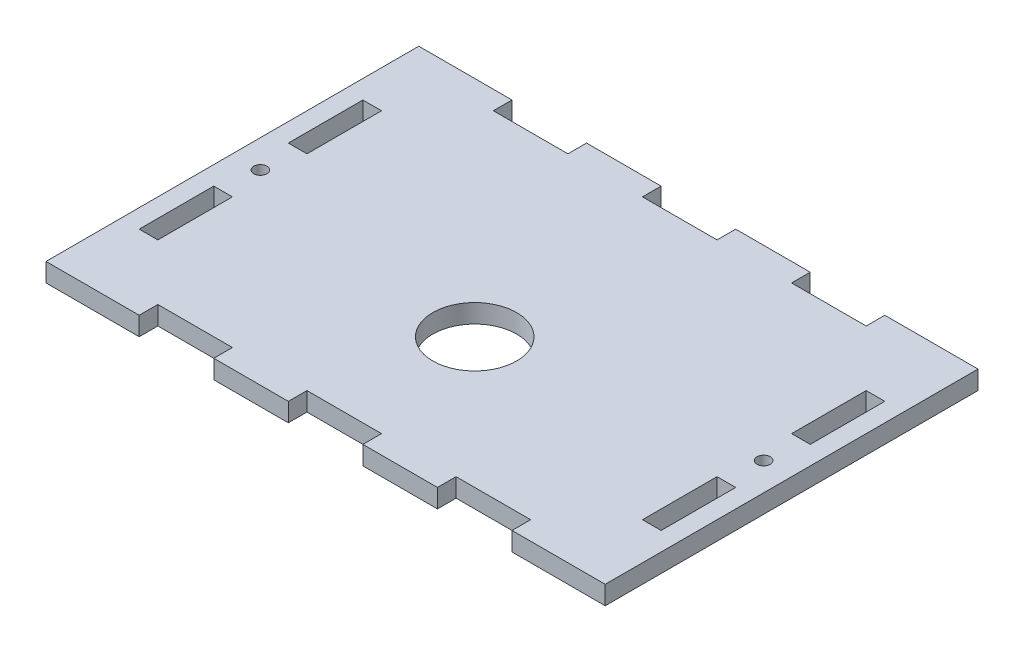
from build123d import *

# Parameters (mm, degrees)
SKETCH1_W                 = 190.5
SKETCH1_H                 = 127
BOSS_EXTRUDE1_DEPTH       = 6.35
SKETCH13_W                = 25.4
SKETCH13_H                = 6.35
CUT_EXTRUDE6_DEPTH        = 6.35
LPATTERN7_COUNT           = 2
LPATTERN7_PITCH           = 120.65
SKETCH14_W                = 6.35
SKETCH14_H                = 25.4
CUT_EXTRUDE7_DEPTH        = 6.35
F_8_CLEARANCE_HOLE1_D     = 4.4958
F_8_CLEARANCE_HOLE1_DEPTH = 10.16
F_8_CLEARANCE_HOLE1_TIP   = 1.350674586
SKETCH18_R                = 14.2875
CUT_EXTRUDE9_DEPTH        = 7.62


with BuildPart() as part:
    # Sketch1 → Boss-Extrude1 (new body)
    with BuildSketch(Plane(origin=(0, 0, 0), x_dir=(1, 0, 0), z_dir=(0, 1, 0))):
        with Locations((95.25, 63.5)):
            Rectangle(SKETCH1_W, SKETCH1_H)
    extrude(amount=BOSS_EXTRUDE1_DEPTH)

    # Sketch13 → Cut-Extrude6 (cut)
    with BuildSketch(Plane(origin=(0, 6.35, 0), x_dir=(1, 0, 0), z_dir=(0, 1, 0))):
        with Locations((44.45, 3.175)):
            Rectangle(SKETCH13_W, SKETCH13_H)
        with Locations((95.25, 3.175)):
            Rectangle(SKETCH13_W, SKETCH13_H)
        with Locations((146.05, 3.175)):
            Rectangle(SKETCH13_W, SKETCH13_H)
    cut_extrude6 = extrude(amount=-CUT_EXTRUDE6_DEPTH, mode=Mode.SUBTRACT)

    # LPattern7: Cut-Extrude6 ×2
    with Locations(*[(0, 0, -i * LPATTERN7_PITCH) for i in range(1, LPATTERN7_COUNT)]):
        add(cut_extrude6, mode=Mode.SUBTRACT)

    # Sketch14 → Cut-Extrude7 (cut)
    with BuildSketch(Plane(origin=(0, 6.35, 0), x_dir=(1, 0, 0), z_dir=(0, 1, 0))):
        with Locations((9.525, 38.1)):
            Rectangle(SKETCH14_W, SKETCH14_H)
        with Locations((180.975, 38.1)):
            Rectangle(SKETCH14_W, SKETCH14_H)
        with Locations((180.975, 88.9)):
            Rectangle(SKETCH14_W, SKETCH14_H)
        with Locations((9.525, 88.9)):
            Rectangle(SKETCH14_W, SKETCH14_H)
    extrude(amount=-CUT_EXTRUDE7_DEPTH, mode=Mode.SUBTRACT)

    # #8 Clearance Hole1
    with Locations(Plane(origin=(0, 6.35, 0), x_dir=(1, 0, 0), z_dir=(0, 1, 0))):
        with Locations((9.525, 63.5), (180.975, 63.5)):
            Hole(F_8_CLEARANCE_HOLE1_D / 2, depth=F_8_CLEARANCE_HOLE1_DEPTH)
            with Locations((0, 0, -(F_8_CLEARANCE_HOLE1_DEPTH + F_8_CLEARANCE_HOLE1_TIP / 2))):  # 118° drill point
                Cone(0, F_8_CLEARANCE_HOLE1_D / 2, F_8_CLEARANCE_HOLE1_TIP, mode=Mode.SUBTRACT)

    # Sketch18 → Cut-Extrude9 (cut)
    with BuildSketch(Plane(origin=(0, 6.35, 0), x_dir=(1, 0, 0), z_dir=(0, 1, 0))):
        with Locations((95.25, 50.8)):
            Circle(SKETCH18_R)
    extrude(amount=-CUT_EXTRUDE9_DEPTH, mode=Mode.SUBTRACT)


solid = part.part
